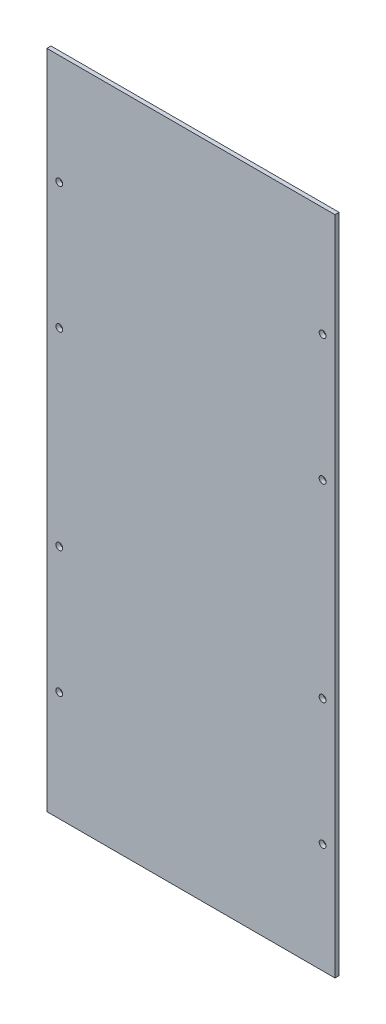
from build123d import *

# Parameters (mm, degrees)
CROQUIS1_W              = 210
CROQUIS1_H              = 482
CROQUIS1_R              = 2.5
SALIENTE_EXTRUIR1_DEPTH = 3


with BuildPart() as part:
    # Croquis1 → Saliente-Extruir1 (new body)
    with BuildSketch(Plane.XY):
        with Locations((14.498385096, 944.628389678)):
            Rectangle(CROQUIS1_W, CROQUIS1_H)
        with Locations((110.498385096, 1105.638389678)):
            Circle(CROQUIS1_R, mode=Mode.SUBTRACT)
        with Locations((-81.501614904, 1105.638389678)):
            Circle(CROQUIS1_R, mode=Mode.SUBTRACT)
        with Locations((-81.501614904, 1013.638389678)):
            Circle(CROQUIS1_R, mode=Mode.SUBTRACT)
        with Locations((110.498385096, 1013.638389678)):
            Circle(CROQUIS1_R, mode=Mode.SUBTRACT)
        with Locations((-81.501614904, 875.618389678)):
            Circle(CROQUIS1_R, mode=Mode.SUBTRACT)
        with Locations((110.498385096, 783.618389678)):
            Circle(CROQUIS1_R, mode=Mode.SUBTRACT)
        with Locations((-81.501614904, 783.618389678)):
            Circle(CROQUIS1_R, mode=Mode.SUBTRACT)
        with Locations((110.498385096, 875.618389678)):
            Circle(CROQUIS1_R, mode=Mode.SUBTRACT)
    extrude(amount=SALIENTE_EXTRUIR1_DEPTH)


solid = part.part
